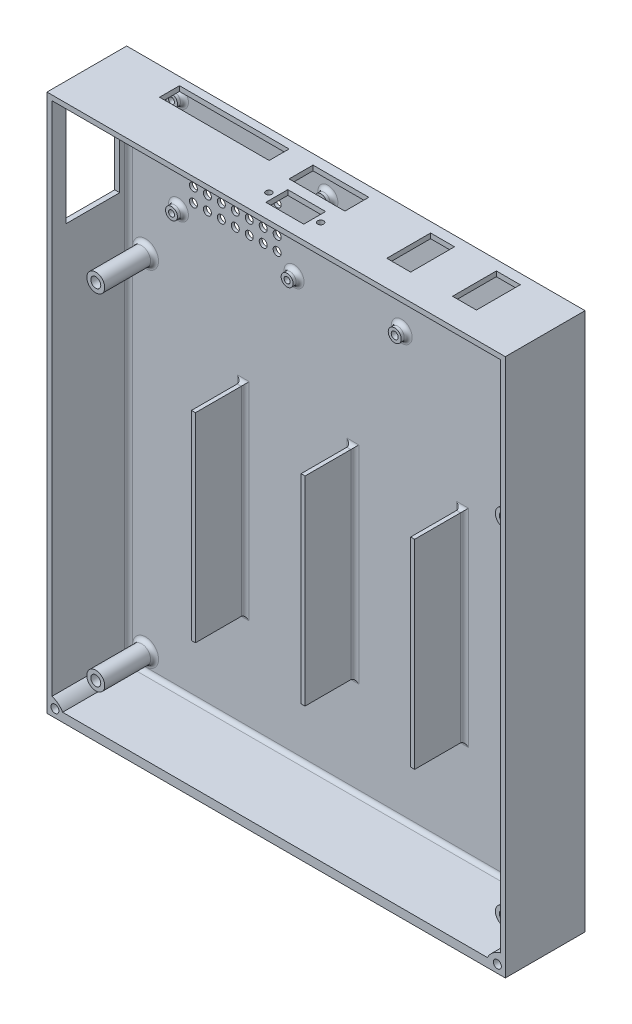
from build123d import *

# Parameters (mm, degrees)
ESQUISSE1_W             = 230
ESQUISSE1_H             = 270
BOSS_EXTRU_1_DEPTH      = 5
ESQUISSE2_R             = 2
ESQUISSE2_R_2           = 1.75
ESQUISSE2_R_3           = 1.5
ENL_V_MAT_EXTRU_1_DEPTH = 5
COQUE3_T                = -1.5
ESQUISSE3_R             = 4.5
ESQUISSE3_R_2           = 2.5
BOSS_EXTRU_3_DEPTH      = 25
ESQUISSE4_W             = 1
ESQUISSE4_H             = 267
BOSS_EXTRU_4_DEPTH      = 3.5
ESQUISSE5_W             = 225
ESQUISSE5_H             = 1
ESQUISSE5_H_2           = 2.9
BOSS_EXTRU_10_DEPTH     = 3.5
ESQUISSE7_W             = 2
ESQUISSE7_H             = 100
BOSS_EXTRU_11_DEPTH     = 25
ESQUISSE8_W             = 230
ESQUISSE8_H             = 270
ESQUISSE8_W_2           = 225
ESQUISSE8_H_2           = 263.1
BOSS_EXTRU_12_DEPTH     = 35
CONG_1_R                = 2
ESQUISSE11_W            = 55
ESQUISSE11_H            = 10
ESQUISSE11_W_2          = 28
ESQUISSE11_H_2          = 12
ESQUISSE11_W_3          = 12
ESQUISSE11_H_3          = 22
ENL_V_MAT_EXTRU_3_DEPTH = 10
ESQUISSE13_W            = 27
ESQUISSE13_H            = 55
ENL_V_MAT_EXTRU_4_DEPTH = 10
ESQUISSE14_R            = 2
ENL_V_MAT_EXTRU_5_DEPTH = 10
BOSS_EXTRU_13_DEPTH     = 40
BOSS_EXTRU_14_START     = 13.5
BOSS_EXTRU_14_DEPTH     = 40
ENL_V_START             = 13.5
ESQUISSE17_R            = 2
ENL_V_MAT_EXTRU_6_DEPTH = 40
ESQUISSE18_R            = 2
ENL_V_MAT_EXTRU_7_DEPTH = 40
ESQUISSE21_R            = 1.5
ESQUISSE21_W            = 19
ESQUISSE21_H            = 11
ENL_V_MAT_EXTRU_8_DEPTH = 2.5


with BuildPart() as part:
    # Esquisse1 → Boss.-Extru.1 (new body)
    with BuildSketch(Plane.XY):
        with Locations((0, -41.5625)):
            Rectangle(ESQUISSE1_W, ESQUISSE1_H)
    extrude(amount=BOSS_EXTRU_1_DEPTH)

    # Esquisse2 → Enlèv. mat.-Extru.1 (cut)
    with BuildSketch(Plane.XY.offset(5)):
        with Locations((-104, -163.5625)):
            Circle(ESQUISSE2_R)
        with Locations(Location((-104, 9.4375, 0), (0, 0, 180))):
            Circle(ESQUISSE2_R)
        with Locations((104.5, 82.9375)):
            Circle(ESQUISSE2_R_2)
        with Locations((24.5, 82.9375)):
            Circle(ESQUISSE2_R_2)
        with Locations(Location((24.5, 39.9375, 0), (0, 0, 180))):
            Circle(ESQUISSE2_R_2)
        with Locations(Location((104.5, 39.9375, 0), (0, 0, 180))):
            Circle(ESQUISSE2_R_2)
        with Locations((-87.5, 85.9375)):
            Circle(ESQUISSE2_R_3)
        with Locations(Location((-29.5, 85.9375, 0), (0, 0, 180))):
            Circle(ESQUISSE2_R_3)
        with Locations((8.5, 67.4375)):
            Circle(ESQUISSE2_R_3)
        with Locations(Location((-12.5, 67.4375, 0), (0, 0, 180))):
            Circle(ESQUISSE2_R_3)
        with Locations((-12.5, 79.9375)):
            Circle(ESQUISSE2_R_3)
        with Locations(Location((8.5, 79.9375, 0), (0, 0, 180))):
            Circle(ESQUISSE2_R_3)
        with Locations(Location((101, -163.5625, 0), (0, 0, 180))):
            Circle(ESQUISSE2_R)
        with Locations((101, 9.4375)):
            Circle(ESQUISSE2_R)
        with Locations(Location((-87.5, 36.9375, 0), (0, 0, 180))):
            Circle(ESQUISSE2_R_3)
        with Locations((-29.5, 36.9375)):
            Circle(ESQUISSE2_R_3)
    extrude(amount=-ENL_V_MAT_EXTRU_1_DEPTH, mode=Mode.SUBTRACT)

    # Coque3
    coque3_openings = [part.faces().sort_by_distance(p)[0] for p in [
        (-0.011238138, -41.697281592, 5),
    ]]
    offset(amount=COQUE3_T, openings=coque3_openings, kind=Kind.INTERSECTION)

    # Esquisse3 → Boss.-Extru.3 (add)
    # profile 1 of 4: a face of its own
    with BuildSketch(Plane.XY.offset(1.5)):
        with Locations(Location((-104, 9.4375, 0), (0, 0, 180))):
            Circle(ESQUISSE3_R)
        with Locations(Location((-104, 9.4375, 0), (0, 0, 180))):
            Circle(ESQUISSE3_R_2, mode=Mode.SUBTRACT)
    # profile 2 of 4: a face of its own
    with BuildSketch(Plane.XY.offset(1.5)):
        with Locations(Location((-104, -163.5625, 0), (0, 0, 180))):
            Circle(ESQUISSE3_R)
        with Locations(Location((-104, -163.5625, 0), (0, 0, 180))):
            Circle(ESQUISSE3_R_2, mode=Mode.SUBTRACT)
    # profile 3 of 4: a face of its own
    with BuildSketch(Plane.XY.offset(1.5)):
        with Locations(Location((101, -163.5625, 0), (0, 0, 180))):
            Circle(ESQUISSE3_R)
        with Locations(Location((101, -163.5625, 0), (0, 0, 180))):
            Circle(ESQUISSE3_R_2, mode=Mode.SUBTRACT)
    # profile 4 of 4: a face of its own
    with BuildSketch(Plane.XY.offset(1.5)):
        with Locations(Location((101, 9.4375, 0), (0, 0, 180))):
            Circle(ESQUISSE3_R)
        with Locations(Location((101, 9.4375, 0), (0, 0, 180))):
            Circle(ESQUISSE3_R_2, mode=Mode.SUBTRACT)
    extrude(amount=BOSS_EXTRU_3_DEPTH)

    # Esquisse4 → Boss.-Extru.4 (add)
    with BuildSketch(Plane.XY.offset(1.5)):
        with Locations((-113, -41.5625)):
            Rectangle(ESQUISSE4_W, ESQUISSE4_H)
        with Locations((113, -41.5625)):
            Rectangle(ESQUISSE4_W, ESQUISSE4_H)
    extrude(amount=BOSS_EXTRU_4_DEPTH)

    # Esquisse5 → Boss.-Extru.10 (add)
    with BuildSketch(Plane.XY.offset(1.5)):
        with Locations((0, 91.4375)):
            Rectangle(ESQUISSE5_W, ESQUISSE5_H)
        with Locations((0, -173.6125)):
            Rectangle(ESQUISSE5_W, ESQUISSE5_H_2)
    extrude(amount=BOSS_EXTRU_10_DEPTH)

    # Esquisse7 → Boss.-Extru.11 (add)
    with BuildSketch(Plane.XY.offset(1.5)):
        with Locations((0, -72.1625)):
            Rectangle(ESQUISSE7_W, ESQUISSE7_H)
        with Locations((-55, -72.1625)):
            Rectangle(ESQUISSE7_W, ESQUISSE7_H)
        with Locations((55, -72.1625)):
            Rectangle(ESQUISSE7_W, ESQUISSE7_H)
    extrude(amount=BOSS_EXTRU_11_DEPTH)

    # Esquisse8 → Boss.-Extru.12 (add)
    with BuildSketch(Plane.XY.offset(5)):
        with Locations((0, -41.5625)):
            Rectangle(ESQUISSE8_W, ESQUISSE8_H)
        with Locations((0, -40.6125)):
            Rectangle(ESQUISSE8_W_2, ESQUISSE8_H_2, mode=Mode.SUBTRACT)
    extrude(amount=BOSS_EXTRU_12_DEPTH)

    # Congé1
    # the kernel refuses this fillet: 2 mm, written as the material it adds along each edge
    with BuildSketch(Plane(origin=(-104, 9.4375, 1.5), x_dir=(-1, 0, 0), z_dir=(0, 1, 0))) as cong_1_piece_1:
        with BuildLine():
            CenterArc((4.5 + CONG_1_R, CONG_1_R), CONG_1_R, 180, 90)
            Line((4.5, CONG_1_R), (4.5 - CONG_1_R * 0.02, CONG_1_R))
            Line((4.5 - CONG_1_R * 0.02, CONG_1_R), (4.5 - CONG_1_R * 0.02, -CONG_1_R * 0.02))
            Line((4.5 - CONG_1_R * 0.02, -CONG_1_R * 0.02), (4.5 + CONG_1_R, -CONG_1_R * 0.02))
            Line((4.5 + CONG_1_R, -CONG_1_R * 0.02), (4.5 + CONG_1_R, 0))
        make_face()
    revolve(axis=Axis((-104, 9.4375, 1.5), (0, 0, 1)))
    with BuildSketch(Plane(origin=(101, -163.5625, 1.5), x_dir=(-1, 0, 0), z_dir=(0, 1, 0))) as cong_1_piece_2:
        with BuildLine():
            CenterArc((4.5 + CONG_1_R, CONG_1_R), CONG_1_R, 180, 90)
            Line((4.5, CONG_1_R), (4.5 - CONG_1_R * 0.02, CONG_1_R))
            Line((4.5 - CONG_1_R * 0.02, CONG_1_R), (4.5 - CONG_1_R * 0.02, -CONG_1_R * 0.02))
            Line((4.5 - CONG_1_R * 0.02, -CONG_1_R * 0.02), (4.5 + CONG_1_R, -CONG_1_R * 0.02))
            Line((4.5 + CONG_1_R, -CONG_1_R * 0.02), (4.5 + CONG_1_R, 0))
        make_face()
    revolve(axis=Axis((101, -163.5625, 1.5), (0, 0, 1)))
    with BuildSketch(Plane(origin=(-104, -163.5625, 1.5), x_dir=(-1, 0, 0), z_dir=(0, 1, 0))) as cong_1_piece_3:
        with BuildLine():
            CenterArc((4.5 + CONG_1_R, CONG_1_R), CONG_1_R, 180, 90)
            Line((4.5, CONG_1_R), (4.5 - CONG_1_R * 0.02, CONG_1_R))
            Line((4.5 - CONG_1_R * 0.02, CONG_1_R), (4.5 - CONG_1_R * 0.02, -CONG_1_R * 0.02))
            Line((4.5 - CONG_1_R * 0.02, -CONG_1_R * 0.02), (4.5 + CONG_1_R, -CONG_1_R * 0.02))
            Line((4.5 + CONG_1_R, -CONG_1_R * 0.02), (4.5 + CONG_1_R, 0))
        make_face()
    revolve(axis=Axis((-104, -163.5625, 1.5), (0, 0, 1)))
    with BuildSketch(Plane(origin=(101, 9.4375, 1.5), x_dir=(-1, 0, 0), z_dir=(0, 1, 0))) as cong_1_piece_4:
        with BuildLine():
            CenterArc((4.5 + CONG_1_R, CONG_1_R), CONG_1_R, 180, 90)
            Line((4.5, CONG_1_R), (4.5 - CONG_1_R * 0.02, CONG_1_R))
            Line((4.5 - CONG_1_R * 0.02, CONG_1_R), (4.5 - CONG_1_R * 0.02, -CONG_1_R * 0.02))
            Line((4.5 - CONG_1_R * 0.02, -CONG_1_R * 0.02), (4.5 + CONG_1_R, -CONG_1_R * 0.02))
            Line((4.5 + CONG_1_R, -CONG_1_R * 0.02), (4.5 + CONG_1_R, 0))
        make_face()
    revolve(axis=Axis((101, 9.4375, 1.5), (0, 0, 1)))
    with BuildSketch(Plane(origin=(112.5, -172.1625, 1.5), x_dir=(-1, 0, 0), z_dir=(0, 1, 0)), Plane(origin=(-112.5, 90.9375, 1.5), x_dir=(1, 0, 0), z_dir=(0, -1, 0))) as cong_1_piece_5:
        with BuildLine():
            CenterArc((CONG_1_R, CONG_1_R), CONG_1_R, 180, 90)
            Line((0, CONG_1_R), (-CONG_1_R * 0.02, CONG_1_R))
            Line((-CONG_1_R * 0.02, CONG_1_R), (-CONG_1_R * 0.02, -CONG_1_R * 0.02))
            Line((-CONG_1_R * 0.02, -CONG_1_R * 0.02), (CONG_1_R, -CONG_1_R * 0.02))
            Line((CONG_1_R, -CONG_1_R * 0.02), (CONG_1_R, 0))
        make_face()
    extrude(amount=263.1)
    with BuildSketch(Plane(origin=(112.5, 90.9375, 1.5), x_dir=(0, -1, 0), z_dir=(-1, 0, 0)), Plane(origin=(-112.5, -172.1625, 1.5), x_dir=(0, 1, 0), z_dir=(1, 0, 0))) as cong_1_piece_6:
        with BuildLine():
            CenterArc((CONG_1_R, CONG_1_R), CONG_1_R, 180, 90)
            Line((0, CONG_1_R), (-CONG_1_R * 0.02, CONG_1_R))
            Line((-CONG_1_R * 0.02, CONG_1_R), (-CONG_1_R * 0.02, -CONG_1_R * 0.02))
            Line((-CONG_1_R * 0.02, -CONG_1_R * 0.02), (CONG_1_R, -CONG_1_R * 0.02))
            Line((CONG_1_R, -CONG_1_R * 0.02), (CONG_1_R, 0))
        make_face()
    extrude(amount=225)
    with BuildSketch(Plane(origin=(-56, -122.1625, 1.5), x_dir=(-1, 0, 0), z_dir=(0, 1, 0)), Plane(origin=(-54, -22.1625, 1.5), x_dir=(1, 0, 0), z_dir=(0, -1, 0)), Plane(origin=(-1, -122.1625, 1.5), x_dir=(-1, 0, 0), z_dir=(0, 1, 0)), Plane(origin=(1, -22.1625, 1.5), x_dir=(1, 0, 0), z_dir=(0, -1, 0)), Plane(origin=(54, -122.1625, 1.5), x_dir=(-1, 0, 0), z_dir=(0, 1, 0)), Plane(origin=(56, -22.1625, 1.5), x_dir=(1, 0, 0), z_dir=(0, -1, 0))) as cong_1_piece_7:
        with BuildLine():
            CenterArc((CONG_1_R, CONG_1_R), CONG_1_R, 180, 90)
            Line((0, CONG_1_R), (-CONG_1_R * 0.02, CONG_1_R))
            Line((-CONG_1_R * 0.02, CONG_1_R), (-CONG_1_R * 0.02, -CONG_1_R * 0.02))
            Line((-CONG_1_R * 0.02, -CONG_1_R * 0.02), (CONG_1_R, -CONG_1_R * 0.02))
            Line((CONG_1_R, -CONG_1_R * 0.02), (CONG_1_R, 0))
        make_face()
    extrude(amount=100)
    with BuildSketch(Plane(origin=(-54, -122.1625, 1.5), x_dir=(0, -1, 0), z_dir=(-1, 0, 0)), Plane(origin=(-56, -22.1625, 1.5), x_dir=(0, 1, 0), z_dir=(1, 0, 0)), Plane(origin=(1, -122.1625, 1.5), x_dir=(0, -1, 0), z_dir=(-1, 0, 0)), Plane(origin=(-1, -22.1625, 1.5), x_dir=(0, 1, 0), z_dir=(1, 0, 0)), Plane(origin=(56, -122.1625, 1.5), x_dir=(0, -1, 0), z_dir=(-1, 0, 0)), Plane(origin=(54, -22.1625, 1.5), x_dir=(0, 1, 0), z_dir=(1, 0, 0))) as cong_1_piece_8:
        with BuildLine():
            CenterArc((CONG_1_R, CONG_1_R), CONG_1_R, 180, 90)
            Line((0, CONG_1_R), (-CONG_1_R * 0.02, CONG_1_R))
            Line((-CONG_1_R * 0.02, CONG_1_R), (-CONG_1_R * 0.02, -CONG_1_R * 0.02))
            Line((-CONG_1_R * 0.02, -CONG_1_R * 0.02), (CONG_1_R, -CONG_1_R * 0.02))
            Line((CONG_1_R, -CONG_1_R * 0.02), (CONG_1_R, 0))
        make_face()
    extrude(amount=2)
    with BuildSketch(Plane(origin=(104.5, 39.9375, 1.5), x_dir=(-1, 0, 0), z_dir=(0, 1, 0))) as cong_1_piece_9:
        with BuildLine():
            CenterArc((3.25 + CONG_1_R, CONG_1_R), CONG_1_R, 180, 90)
            Line((3.25, CONG_1_R), (3.25 - CONG_1_R * 0.02, CONG_1_R))
            Line((3.25 - CONG_1_R * 0.02, CONG_1_R), (3.25 - CONG_1_R * 0.02, -CONG_1_R * 0.02))
            Line((3.25 - CONG_1_R * 0.02, -CONG_1_R * 0.02), (3.25 + CONG_1_R, -CONG_1_R * 0.02))
            Line((3.25 + CONG_1_R, -CONG_1_R * 0.02), (3.25 + CONG_1_R, 0))
        make_face()
    revolve(axis=Axis((104.5, 39.9375, 1.5), (0, 0, 1)))
    with BuildSketch(Plane(origin=(24.5, 39.9375, 1.5), x_dir=(-1, 0, 0), z_dir=(0, 1, 0))) as cong_1_piece_10:
        with BuildLine():
            CenterArc((3.25 + CONG_1_R, CONG_1_R), CONG_1_R, 180, 90)
            Line((3.25, CONG_1_R), (3.25 - CONG_1_R * 0.02, CONG_1_R))
            Line((3.25 - CONG_1_R * 0.02, CONG_1_R), (3.25 - CONG_1_R * 0.02, -CONG_1_R * 0.02))
            Line((3.25 - CONG_1_R * 0.02, -CONG_1_R * 0.02), (3.25 + CONG_1_R, -CONG_1_R * 0.02))
            Line((3.25 + CONG_1_R, -CONG_1_R * 0.02), (3.25 + CONG_1_R, 0))
        make_face()
    revolve(axis=Axis((24.5, 39.9375, 1.5), (0, 0, 1)))
    with BuildSketch(Plane(origin=(24.5, 82.9375, 1.5), x_dir=(1, 0, 0), z_dir=(0, -1, 0))) as cong_1_piece_11:
        with BuildLine():
            CenterArc((3.25 + CONG_1_R, CONG_1_R), CONG_1_R, 180, 90)
            Line((3.25, CONG_1_R), (3.25 - CONG_1_R * 0.02, CONG_1_R))
            Line((3.25 - CONG_1_R * 0.02, CONG_1_R), (3.25 - CONG_1_R * 0.02, -CONG_1_R * 0.02))
            Line((3.25 - CONG_1_R * 0.02, -CONG_1_R * 0.02), (3.25 + CONG_1_R, -CONG_1_R * 0.02))
            Line((3.25 + CONG_1_R, -CONG_1_R * 0.02), (3.25 + CONG_1_R, 0))
        make_face()
    revolve(axis=Axis((24.5, 82.9375, 1.5), (0, 0, 1)))
    with BuildSketch(Plane(origin=(104.5, 82.9375, 1.5), x_dir=(1, 0, 0), z_dir=(0, -1, 0))) as cong_1_piece_12:
        with BuildLine():
            CenterArc((3.25 + CONG_1_R, CONG_1_R), CONG_1_R, 180, 90)
            Line((3.25 + CONG_1_R, 0), (3.25 + CONG_1_R, -CONG_1_R * 0.02))
            Line((3.25 + CONG_1_R, -CONG_1_R * 0.02), (3.25 - CONG_1_R * 0.02, -CONG_1_R * 0.02))
            Line((3.25 - CONG_1_R * 0.02, -CONG_1_R * 0.02), (3.25 - CONG_1_R * 0.02, CONG_1_R))
            Line((3.25 - CONG_1_R * 0.02, CONG_1_R), (3.25, CONG_1_R))
        make_face()
    revolve(axis=Axis((104.5, 82.9375, 1.5), (0, 0, 1)))
    with BuildSketch(Plane(origin=(8.5, 67.4375, 1.5), x_dir=(1, 0, 0), z_dir=(0, -1, 0))) as cong_1_piece_13:
        with BuildLine():
            CenterArc((3 + CONG_1_R, CONG_1_R), CONG_1_R, 180, 90)
            Line((3, CONG_1_R), (3 - CONG_1_R * 0.02, CONG_1_R))
            Line((3 - CONG_1_R * 0.02, CONG_1_R), (3 - CONG_1_R * 0.02, -CONG_1_R * 0.02))
            Line((3 - CONG_1_R * 0.02, -CONG_1_R * 0.02), (3 + CONG_1_R, -CONG_1_R * 0.02))
            Line((3 + CONG_1_R, -CONG_1_R * 0.02), (3 + CONG_1_R, 0))
        make_face()
    revolve(axis=Axis((8.5, 67.4375, 1.5), (0, 0, 1)))
    with BuildSketch(Plane(origin=(-87.5, 85.9375, 1.5), x_dir=(1, 0, 0), z_dir=(0, -1, 0))) as cong_1_piece_14:
        with BuildLine():
            CenterArc((3 + CONG_1_R, CONG_1_R), CONG_1_R, 180, 90)
            Line((3, CONG_1_R), (3 - CONG_1_R * 0.02, CONG_1_R))
            Line((3 - CONG_1_R * 0.02, CONG_1_R), (3 - CONG_1_R * 0.02, -CONG_1_R * 0.02))
            Line((3 - CONG_1_R * 0.02, -CONG_1_R * 0.02), (3 + CONG_1_R, -CONG_1_R * 0.02))
            Line((3 + CONG_1_R, -CONG_1_R * 0.02), (3 + CONG_1_R, 0))
        make_face()
    revolve(axis=Axis((-87.5, 85.9375, 1.5), (0, 0, 1)))
    with BuildSketch(Plane(origin=(-29.5, 85.9375, 1.5), x_dir=(-1, 0, 0), z_dir=(0, 1, 0))) as cong_1_piece_15:
        with BuildLine():
            CenterArc((3 + CONG_1_R, CONG_1_R), CONG_1_R, 180, 90)
            Line((3, CONG_1_R), (3 - CONG_1_R * 0.02, CONG_1_R))
            Line((3 - CONG_1_R * 0.02, CONG_1_R), (3 - CONG_1_R * 0.02, -CONG_1_R * 0.02))
            Line((3 - CONG_1_R * 0.02, -CONG_1_R * 0.02), (3 + CONG_1_R, -CONG_1_R * 0.02))
            Line((3 + CONG_1_R, -CONG_1_R * 0.02), (3 + CONG_1_R, 0))
        make_face()
    revolve(axis=Axis((-29.5, 85.9375, 1.5), (0, 0, 1)))
    with BuildSketch(Plane(origin=(-87.5, 36.9375, 1.5), x_dir=(-1, 0, 0), z_dir=(0, 1, 0))) as cong_1_piece_16:
        with BuildLine():
            CenterArc((3 + CONG_1_R, CONG_1_R), CONG_1_R, 180, 90)
            Line((3, CONG_1_R), (3 - CONG_1_R * 0.02, CONG_1_R))
            Line((3 - CONG_1_R * 0.02, CONG_1_R), (3 - CONG_1_R * 0.02, -CONG_1_R * 0.02))
            Line((3 - CONG_1_R * 0.02, -CONG_1_R * 0.02), (3 + CONG_1_R, -CONG_1_R * 0.02))
            Line((3 + CONG_1_R, -CONG_1_R * 0.02), (3 + CONG_1_R, 0))
        make_face()
    revolve(axis=Axis((-87.5, 36.9375, 1.5), (0, 0, 1)))
    with BuildSketch(Plane(origin=(-29.5, 36.9375, 1.5), x_dir=(1, 0, 0), z_dir=(0, -1, 0))) as cong_1_piece_17:
        with BuildLine():
            CenterArc((3 + CONG_1_R, CONG_1_R), CONG_1_R, 180, 90)
            Line((3, CONG_1_R), (3 - CONG_1_R * 0.02, CONG_1_R))
            Line((3 - CONG_1_R * 0.02, CONG_1_R), (3 - CONG_1_R * 0.02, -CONG_1_R * 0.02))
            Line((3 - CONG_1_R * 0.02, -CONG_1_R * 0.02), (3 + CONG_1_R, -CONG_1_R * 0.02))
            Line((3 + CONG_1_R, -CONG_1_R * 0.02), (3 + CONG_1_R, 0))
        make_face()
    revolve(axis=Axis((-29.5, 36.9375, 1.5), (0, 0, 1)))
    with BuildSketch(Plane(origin=(-12.5, 67.4375, 1.5), x_dir=(-1, 0, 0), z_dir=(0, 1, 0))) as cong_1_piece_18:
        with BuildLine():
            CenterArc((3 + CONG_1_R, CONG_1_R), CONG_1_R, 180, 90)
            Line((3, CONG_1_R), (3 - CONG_1_R * 0.02, CONG_1_R))
            Line((3 - CONG_1_R * 0.02, CONG_1_R), (3 - CONG_1_R * 0.02, -CONG_1_R * 0.02))
            Line((3 - CONG_1_R * 0.02, -CONG_1_R * 0.02), (3 + CONG_1_R, -CONG_1_R * 0.02))
            Line((3 + CONG_1_R, -CONG_1_R * 0.02), (3 + CONG_1_R, 0))
        make_face()
    revolve(axis=Axis((-12.5, 67.4375, 1.5), (0, 0, 1)))
    with BuildSketch(Plane(origin=(-12.5, 79.9375, 1.5), x_dir=(1, 0, 0), z_dir=(0, -1, 0))) as cong_1_piece_19:
        with BuildLine():
            CenterArc((3 + CONG_1_R, CONG_1_R), CONG_1_R, 180, 90)
            Line((3, CONG_1_R), (3 - CONG_1_R * 0.02, CONG_1_R))
            Line((3 - CONG_1_R * 0.02, CONG_1_R), (3 - CONG_1_R * 0.02, -CONG_1_R * 0.02))
            Line((3 - CONG_1_R * 0.02, -CONG_1_R * 0.02), (3 + CONG_1_R, -CONG_1_R * 0.02))
            Line((3 + CONG_1_R, -CONG_1_R * 0.02), (3 + CONG_1_R, 0))
        make_face()
    revolve(axis=Axis((-12.5, 79.9375, 1.5), (0, 0, 1)))
    with BuildSketch(Plane(origin=(8.5, 79.9375, 1.5), x_dir=(-1, 0, 0), z_dir=(0, 1, 0))) as cong_1_piece_20:
        with BuildLine():
            CenterArc((3 + CONG_1_R, CONG_1_R), CONG_1_R, 180, 90)
            Line((3, CONG_1_R), (3 - CONG_1_R * 0.02, CONG_1_R))
            Line((3 - CONG_1_R * 0.02, CONG_1_R), (3 - CONG_1_R * 0.02, -CONG_1_R * 0.02))
            Line((3 - CONG_1_R * 0.02, -CONG_1_R * 0.02), (3 + CONG_1_R, -CONG_1_R * 0.02))
            Line((3 + CONG_1_R, -CONG_1_R * 0.02), (3 + CONG_1_R, 0))
        make_face()
    revolve(axis=Axis((8.5, 79.9375, 1.5), (0, 0, 1)))
    with BuildSketch(Plane(origin=(-112.5, -172.1625, 1.5), x_dir=(0, 1, 0), z_dir=(1, 0, 0))) as cong_1_piece_21a_section:
        with BuildLine():
            CenterArc((CONG_1_R, CONG_1_R), CONG_1_R, 180, 90)
            Line((0, CONG_1_R), (-CONG_1_R * 0.02, CONG_1_R))
            Line((-CONG_1_R * 0.02, CONG_1_R), (-CONG_1_R * 0.02, -CONG_1_R * 0.02))
            Line((-CONG_1_R * 0.02, -CONG_1_R * 0.02), (CONG_1_R, -CONG_1_R * 0.02))
            Line((CONG_1_R, -CONG_1_R * 0.02), (CONG_1_R, 0))
        make_face()
    cong_1_piece_21a = extrude(amount=230, mode=Mode.PRIVATE)
    cong_1_piece_21a = split(cong_1_piece_21a, bisect_by=Plane(origin=(112.5, -171.709709771, 1.952790229), z_dir=(1, 0, 0)), keep=Keep.TOP, mode=Mode.PRIVATE)
    with BuildSketch(Plane(origin=(112.5, -177.1625, 1.5), x_dir=(-1, 0, 0), z_dir=(0, 1, 0))) as cong_1_piece_21b_section:
        with BuildLine():
            CenterArc((CONG_1_R, CONG_1_R), CONG_1_R, 180, 90)
            Line((0, CONG_1_R), (-CONG_1_R * 0.02, CONG_1_R))
            Line((-CONG_1_R * 0.02, CONG_1_R), (-CONG_1_R * 0.02, -CONG_1_R * 0.02))
            Line((-CONG_1_R * 0.02, -CONG_1_R * 0.02), (CONG_1_R, -CONG_1_R * 0.02))
            Line((CONG_1_R, -CONG_1_R * 0.02), (CONG_1_R, 0))
        make_face()
    cong_1_piece_21b = extrude(amount=268.1, mode=Mode.PRIVATE)
    cong_1_piece_21b = split(cong_1_piece_21b, bisect_by=Plane(origin=(112.047209771, -172.1625, 1.952790229), z_dir=(0, -1, 0)), keep=Keep.TOP, mode=Mode.PRIVATE)
    cong_1_piece_21 = cong_1_piece_21a & cong_1_piece_21b
    add(cong_1_piece_21)
    with BuildSketch(Plane(origin=(112.5, -172.1625, 1.5), x_dir=(-1, 0, 0), z_dir=(0, 1, 0))) as cong_1_piece_22a_section:
        with BuildLine():
            CenterArc((CONG_1_R, CONG_1_R), CONG_1_R, 180, 90)
            Line((0, CONG_1_R), (-CONG_1_R * 0.02, CONG_1_R))
            Line((-CONG_1_R * 0.02, CONG_1_R), (-CONG_1_R * 0.02, -CONG_1_R * 0.02))
            Line((-CONG_1_R * 0.02, -CONG_1_R * 0.02), (CONG_1_R, -CONG_1_R * 0.02))
            Line((CONG_1_R, -CONG_1_R * 0.02), (CONG_1_R, 0))
        make_face()
    cong_1_piece_22a = extrude(amount=268.1, mode=Mode.PRIVATE)
    cong_1_piece_22a = split(cong_1_piece_22a, bisect_by=Plane(origin=(112.047209771, 90.9375, 1.952790229), z_dir=(0, 1, 0)), keep=Keep.TOP, mode=Mode.PRIVATE)
    with BuildSketch(Plane(origin=(117.5, 90.9375, 1.5), x_dir=(0, -1, 0), z_dir=(-1, 0, 0))) as cong_1_piece_22b_section:
        with BuildLine():
            CenterArc((CONG_1_R, CONG_1_R), CONG_1_R, 180, 90)
            Line((0, CONG_1_R), (-CONG_1_R * 0.02, CONG_1_R))
            Line((-CONG_1_R * 0.02, CONG_1_R), (-CONG_1_R * 0.02, -CONG_1_R * 0.02))
            Line((-CONG_1_R * 0.02, -CONG_1_R * 0.02), (CONG_1_R, -CONG_1_R * 0.02))
            Line((CONG_1_R, -CONG_1_R * 0.02), (CONG_1_R, 0))
        make_face()
    cong_1_piece_22b = extrude(amount=230, mode=Mode.PRIVATE)
    cong_1_piece_22b = split(cong_1_piece_22b, bisect_by=Plane(origin=(112.5, 90.484709771, 1.952790229), z_dir=(1, 0, 0)), keep=Keep.TOP, mode=Mode.PRIVATE)
    cong_1_piece_22 = cong_1_piece_22a & cong_1_piece_22b
    add(cong_1_piece_22)
    with BuildSketch(Plane(origin=(-112.5, 95.9375, 1.5), x_dir=(1, 0, 0), z_dir=(0, -1, 0))) as cong_1_piece_23a_section:
        with BuildLine():
            CenterArc((CONG_1_R, CONG_1_R), CONG_1_R, 180, 90)
            Line((0, CONG_1_R), (-CONG_1_R * 0.02, CONG_1_R))
            Line((-CONG_1_R * 0.02, CONG_1_R), (-CONG_1_R * 0.02, -CONG_1_R * 0.02))
            Line((-CONG_1_R * 0.02, -CONG_1_R * 0.02), (CONG_1_R, -CONG_1_R * 0.02))
            Line((CONG_1_R, -CONG_1_R * 0.02), (CONG_1_R, 0))
        make_face()
    cong_1_piece_23a = extrude(amount=268.1, mode=Mode.PRIVATE)
    cong_1_piece_23a = split(cong_1_piece_23a, bisect_by=Plane(origin=(-112.047209771, 90.9375, 1.952790229), z_dir=(0, 1, 0)), keep=Keep.TOP, mode=Mode.PRIVATE)
    with BuildSketch(Plane(origin=(112.5, 90.9375, 1.5), x_dir=(0, -1, 0), z_dir=(-1, 0, 0))) as cong_1_piece_23b_section:
        with BuildLine():
            CenterArc((CONG_1_R, CONG_1_R), CONG_1_R, 180, 90)
            Line((0, CONG_1_R), (-CONG_1_R * 0.02, CONG_1_R))
            Line((-CONG_1_R * 0.02, CONG_1_R), (-CONG_1_R * 0.02, -CONG_1_R * 0.02))
            Line((-CONG_1_R * 0.02, -CONG_1_R * 0.02), (CONG_1_R, -CONG_1_R * 0.02))
            Line((CONG_1_R, -CONG_1_R * 0.02), (CONG_1_R, 0))
        make_face()
    cong_1_piece_23b = extrude(amount=230, mode=Mode.PRIVATE)
    cong_1_piece_23b = split(cong_1_piece_23b, bisect_by=Plane(origin=(-112.5, 90.484709771, 1.952790229), z_dir=(-1, 0, 0)), keep=Keep.TOP, mode=Mode.PRIVATE)
    cong_1_piece_23 = cong_1_piece_23a & cong_1_piece_23b
    add(cong_1_piece_23)
    with BuildSketch(Plane(origin=(-117.5, -172.1625, 1.5), x_dir=(0, 1, 0), z_dir=(1, 0, 0))) as cong_1_piece_24a_section:
        with BuildLine():
            CenterArc((CONG_1_R, CONG_1_R), CONG_1_R, 180, 90)
            Line((0, CONG_1_R), (-CONG_1_R * 0.02, CONG_1_R))
            Line((-CONG_1_R * 0.02, CONG_1_R), (-CONG_1_R * 0.02, -CONG_1_R * 0.02))
            Line((-CONG_1_R * 0.02, -CONG_1_R * 0.02), (CONG_1_R, -CONG_1_R * 0.02))
            Line((CONG_1_R, -CONG_1_R * 0.02), (CONG_1_R, 0))
        make_face()
    cong_1_piece_24a = extrude(amount=230, mode=Mode.PRIVATE)
    cong_1_piece_24a = split(cong_1_piece_24a, bisect_by=Plane(origin=(-112.5, -171.709709771, 1.952790229), z_dir=(-1, 0, 0)), keep=Keep.TOP, mode=Mode.PRIVATE)
    with BuildSketch(Plane(origin=(-112.5, 90.9375, 1.5), x_dir=(1, 0, 0), z_dir=(0, -1, 0))) as cong_1_piece_24b_section:
        with BuildLine():
            CenterArc((CONG_1_R, CONG_1_R), CONG_1_R, 180, 90)
            Line((0, CONG_1_R), (-CONG_1_R * 0.02, CONG_1_R))
            Line((-CONG_1_R * 0.02, CONG_1_R), (-CONG_1_R * 0.02, -CONG_1_R * 0.02))
            Line((-CONG_1_R * 0.02, -CONG_1_R * 0.02), (CONG_1_R, -CONG_1_R * 0.02))
            Line((CONG_1_R, -CONG_1_R * 0.02), (CONG_1_R, 0))
        make_face()
    cong_1_piece_24b = extrude(amount=268.1, mode=Mode.PRIVATE)
    cong_1_piece_24b = split(cong_1_piece_24b, bisect_by=Plane(origin=(-112.047209771, -172.1625, 1.952790229), z_dir=(0, -1, 0)), keep=Keep.TOP, mode=Mode.PRIVATE)
    cong_1_piece_24 = cong_1_piece_24a & cong_1_piece_24b
    add(cong_1_piece_24)
    with BuildSketch(Plane(origin=(-56, -127.1625, 1.5), x_dir=(-1, 0, 0), z_dir=(0, 1, 0))) as cong_1_piece_25a_section:
        with BuildLine():
            CenterArc((CONG_1_R, CONG_1_R), CONG_1_R, 180, 90)
            Line((0, CONG_1_R), (-CONG_1_R * 0.02, CONG_1_R))
            Line((-CONG_1_R * 0.02, CONG_1_R), (-CONG_1_R * 0.02, -CONG_1_R * 0.02))
            Line((-CONG_1_R * 0.02, -CONG_1_R * 0.02), (CONG_1_R, -CONG_1_R * 0.02))
            Line((CONG_1_R, -CONG_1_R * 0.02), (CONG_1_R, 0))
        make_face()
    cong_1_piece_25a = extrude(amount=105, mode=Mode.PRIVATE)
    cong_1_piece_25a = split(cong_1_piece_25a, bisect_by=Plane(origin=(-56.452790229, -122.1625, 1.952790229), z_dir=(0, -1, 0)), keep=Keep.TOP, mode=Mode.PRIVATE)
    with BuildSketch(Plane(origin=(-54, -122.1625, 1.5), x_dir=(0, -1, 0), z_dir=(-1, 0, 0))) as cong_1_piece_25b_section:
        with BuildLine():
            CenterArc((CONG_1_R, CONG_1_R), CONG_1_R, 180, 90)
            Line((0, CONG_1_R), (-CONG_1_R * 0.02, CONG_1_R))
            Line((-CONG_1_R * 0.02, CONG_1_R), (-CONG_1_R * 0.02, -CONG_1_R * 0.02))
            Line((-CONG_1_R * 0.02, -CONG_1_R * 0.02), (CONG_1_R, -CONG_1_R * 0.02))
            Line((CONG_1_R, -CONG_1_R * 0.02), (CONG_1_R, 0))
        make_face()
    cong_1_piece_25b = extrude(amount=7, mode=Mode.PRIVATE)
    cong_1_piece_25b = split(cong_1_piece_25b, bisect_by=Plane(origin=(-56, -122.615290229, 1.952790229), z_dir=(-1, 0, 0)), keep=Keep.TOP, mode=Mode.PRIVATE)
    cong_1_piece_25 = cong_1_piece_25a & cong_1_piece_25b
    add(cong_1_piece_25)
    with BuildSketch(Plane(origin=(-56, -122.1625, 1.5), x_dir=(-1, 0, 0), z_dir=(0, 1, 0))) as cong_1_piece_26a_section:
        with BuildLine():
            CenterArc((CONG_1_R, CONG_1_R), CONG_1_R, 180, 90)
            Line((0, CONG_1_R), (-CONG_1_R * 0.02, CONG_1_R))
            Line((-CONG_1_R * 0.02, CONG_1_R), (-CONG_1_R * 0.02, -CONG_1_R * 0.02))
            Line((-CONG_1_R * 0.02, -CONG_1_R * 0.02), (CONG_1_R, -CONG_1_R * 0.02))
            Line((CONG_1_R, -CONG_1_R * 0.02), (CONG_1_R, 0))
        make_face()
    cong_1_piece_26a = extrude(amount=105, mode=Mode.PRIVATE)
    cong_1_piece_26a = split(cong_1_piece_26a, bisect_by=Plane(origin=(-56.452790229, -22.1625, 1.952790229), z_dir=(0, 1, 0)), keep=Keep.TOP, mode=Mode.PRIVATE)
    with BuildSketch(Plane(origin=(-61, -22.1625, 1.5), x_dir=(0, 1, 0), z_dir=(1, 0, 0))) as cong_1_piece_26b_section:
        with BuildLine():
            CenterArc((CONG_1_R, CONG_1_R), CONG_1_R, 180, 90)
            Line((0, CONG_1_R), (-CONG_1_R * 0.02, CONG_1_R))
            Line((-CONG_1_R * 0.02, CONG_1_R), (-CONG_1_R * 0.02, -CONG_1_R * 0.02))
            Line((-CONG_1_R * 0.02, -CONG_1_R * 0.02), (CONG_1_R, -CONG_1_R * 0.02))
            Line((CONG_1_R, -CONG_1_R * 0.02), (CONG_1_R, 0))
        make_face()
    cong_1_piece_26b = extrude(amount=7, mode=Mode.PRIVATE)
    cong_1_piece_26b = split(cong_1_piece_26b, bisect_by=Plane(origin=(-56, -21.709709771, 1.952790229), z_dir=(-1, 0, 0)), keep=Keep.TOP, mode=Mode.PRIVATE)
    cong_1_piece_26 = cong_1_piece_26a & cong_1_piece_26b
    add(cong_1_piece_26)
    with BuildSketch(Plane(origin=(-49, -122.1625, 1.5), x_dir=(0, -1, 0), z_dir=(-1, 0, 0))) as cong_1_piece_27a_section:
        with BuildLine():
            CenterArc((CONG_1_R, CONG_1_R), CONG_1_R, 180, 90)
            Line((0, CONG_1_R), (-CONG_1_R * 0.02, CONG_1_R))
            Line((-CONG_1_R * 0.02, CONG_1_R), (-CONG_1_R * 0.02, -CONG_1_R * 0.02))
            Line((-CONG_1_R * 0.02, -CONG_1_R * 0.02), (CONG_1_R, -CONG_1_R * 0.02))
            Line((CONG_1_R, -CONG_1_R * 0.02), (CONG_1_R, 0))
        make_face()
    cong_1_piece_27a = extrude(amount=7, mode=Mode.PRIVATE)
    cong_1_piece_27a = split(cong_1_piece_27a, bisect_by=Plane(origin=(-54, -122.615290229, 1.952790229), z_dir=(1, 0, 0)), keep=Keep.TOP, mode=Mode.PRIVATE)
    with BuildSketch(Plane(origin=(-54, -22.1625, 1.5), x_dir=(1, 0, 0), z_dir=(0, -1, 0))) as cong_1_piece_27b_section:
        with BuildLine():
            CenterArc((CONG_1_R, CONG_1_R), CONG_1_R, 180, 90)
            Line((0, CONG_1_R), (-CONG_1_R * 0.02, CONG_1_R))
            Line((-CONG_1_R * 0.02, CONG_1_R), (-CONG_1_R * 0.02, -CONG_1_R * 0.02))
            Line((-CONG_1_R * 0.02, -CONG_1_R * 0.02), (CONG_1_R, -CONG_1_R * 0.02))
            Line((CONG_1_R, -CONG_1_R * 0.02), (CONG_1_R, 0))
        make_face()
    cong_1_piece_27b = extrude(amount=105, mode=Mode.PRIVATE)
    cong_1_piece_27b = split(cong_1_piece_27b, bisect_by=Plane(origin=(-53.547209771, -122.1625, 1.952790229), z_dir=(0, -1, 0)), keep=Keep.TOP, mode=Mode.PRIVATE)
    cong_1_piece_27 = cong_1_piece_27a & cong_1_piece_27b
    add(cong_1_piece_27)
    with BuildSketch(Plane(origin=(-54, -17.1625, 1.5), x_dir=(1, 0, 0), z_dir=(0, -1, 0))) as cong_1_piece_28a_section:
        with BuildLine():
            CenterArc((CONG_1_R, CONG_1_R), CONG_1_R, 180, 90)
            Line((0, CONG_1_R), (-CONG_1_R * 0.02, CONG_1_R))
            Line((-CONG_1_R * 0.02, CONG_1_R), (-CONG_1_R * 0.02, -CONG_1_R * 0.02))
            Line((-CONG_1_R * 0.02, -CONG_1_R * 0.02), (CONG_1_R, -CONG_1_R * 0.02))
            Line((CONG_1_R, -CONG_1_R * 0.02), (CONG_1_R, 0))
        make_face()
    cong_1_piece_28a = extrude(amount=105, mode=Mode.PRIVATE)
    cong_1_piece_28a = split(cong_1_piece_28a, bisect_by=Plane(origin=(-53.547209771, -22.1625, 1.952790229), z_dir=(0, 1, 0)), keep=Keep.TOP, mode=Mode.PRIVATE)
    with BuildSketch(Plane(origin=(-56, -22.1625, 1.5), x_dir=(0, 1, 0), z_dir=(1, 0, 0))) as cong_1_piece_28b_section:
        with BuildLine():
            CenterArc((CONG_1_R, CONG_1_R), CONG_1_R, 180, 90)
            Line((0, CONG_1_R), (-CONG_1_R * 0.02, CONG_1_R))
            Line((-CONG_1_R * 0.02, CONG_1_R), (-CONG_1_R * 0.02, -CONG_1_R * 0.02))
            Line((-CONG_1_R * 0.02, -CONG_1_R * 0.02), (CONG_1_R, -CONG_1_R * 0.02))
            Line((CONG_1_R, -CONG_1_R * 0.02), (CONG_1_R, 0))
        make_face()
    cong_1_piece_28b = extrude(amount=7, mode=Mode.PRIVATE)
    cong_1_piece_28b = split(cong_1_piece_28b, bisect_by=Plane(origin=(-54, -21.709709771, 1.952790229), z_dir=(1, 0, 0)), keep=Keep.TOP, mode=Mode.PRIVATE)
    cong_1_piece_28 = cong_1_piece_28a & cong_1_piece_28b
    add(cong_1_piece_28)
    with BuildSketch(Plane(origin=(-1, -127.1625, 1.5), x_dir=(-1, 0, 0), z_dir=(0, 1, 0))) as cong_1_piece_29a_section:
        with BuildLine():
            CenterArc((CONG_1_R, CONG_1_R), CONG_1_R, 180, 90)
            Line((0, CONG_1_R), (-CONG_1_R * 0.02, CONG_1_R))
            Line((-CONG_1_R * 0.02, CONG_1_R), (-CONG_1_R * 0.02, -CONG_1_R * 0.02))
            Line((-CONG_1_R * 0.02, -CONG_1_R * 0.02), (CONG_1_R, -CONG_1_R * 0.02))
            Line((CONG_1_R, -CONG_1_R * 0.02), (CONG_1_R, 0))
        make_face()
    cong_1_piece_29a = extrude(amount=105, mode=Mode.PRIVATE)
    cong_1_piece_29a = split(cong_1_piece_29a, bisect_by=Plane(origin=(-1.452790229, -122.1625, 1.952790229), z_dir=(0, -1, 0)), keep=Keep.TOP, mode=Mode.PRIVATE)
    with BuildSketch(Plane(origin=(1, -122.1625, 1.5), x_dir=(0, -1, 0), z_dir=(-1, 0, 0))) as cong_1_piece_29b_section:
        with BuildLine():
            CenterArc((CONG_1_R, CONG_1_R), CONG_1_R, 180, 90)
            Line((0, CONG_1_R), (-CONG_1_R * 0.02, CONG_1_R))
            Line((-CONG_1_R * 0.02, CONG_1_R), (-CONG_1_R * 0.02, -CONG_1_R * 0.02))
            Line((-CONG_1_R * 0.02, -CONG_1_R * 0.02), (CONG_1_R, -CONG_1_R * 0.02))
            Line((CONG_1_R, -CONG_1_R * 0.02), (CONG_1_R, 0))
        make_face()
    cong_1_piece_29b = extrude(amount=7, mode=Mode.PRIVATE)
    cong_1_piece_29b = split(cong_1_piece_29b, bisect_by=Plane(origin=(-1, -122.615290229, 1.952790229), z_dir=(-1, 0, 0)), keep=Keep.TOP, mode=Mode.PRIVATE)
    cong_1_piece_29 = cong_1_piece_29a & cong_1_piece_29b
    add(cong_1_piece_29)
    with BuildSketch(Plane(origin=(-6, -22.1625, 1.5), x_dir=(0, 1, 0), z_dir=(1, 0, 0))) as cong_1_piece_30a_section:
        with BuildLine():
            CenterArc((CONG_1_R, CONG_1_R), CONG_1_R, 180, 90)
            Line((0, CONG_1_R), (-CONG_1_R * 0.02, CONG_1_R))
            Line((-CONG_1_R * 0.02, CONG_1_R), (-CONG_1_R * 0.02, -CONG_1_R * 0.02))
            Line((-CONG_1_R * 0.02, -CONG_1_R * 0.02), (CONG_1_R, -CONG_1_R * 0.02))
            Line((CONG_1_R, -CONG_1_R * 0.02), (CONG_1_R, 0))
        make_face()
    cong_1_piece_30a = extrude(amount=7, mode=Mode.PRIVATE)
    cong_1_piece_30a = split(cong_1_piece_30a, bisect_by=Plane(origin=(-1, -21.709709771, 1.952790229), z_dir=(-1, 0, 0)), keep=Keep.TOP, mode=Mode.PRIVATE)
    with BuildSketch(Plane(origin=(-1, -122.1625, 1.5), x_dir=(-1, 0, 0), z_dir=(0, 1, 0))) as cong_1_piece_30b_section:
        with BuildLine():
            CenterArc((CONG_1_R, CONG_1_R), CONG_1_R, 180, 90)
            Line((0, CONG_1_R), (-CONG_1_R * 0.02, CONG_1_R))
            Line((-CONG_1_R * 0.02, CONG_1_R), (-CONG_1_R * 0.02, -CONG_1_R * 0.02))
            Line((-CONG_1_R * 0.02, -CONG_1_R * 0.02), (CONG_1_R, -CONG_1_R * 0.02))
            Line((CONG_1_R, -CONG_1_R * 0.02), (CONG_1_R, 0))
        make_face()
    cong_1_piece_30b = extrude(amount=105, mode=Mode.PRIVATE)
    cong_1_piece_30b = split(cong_1_piece_30b, bisect_by=Plane(origin=(-1.452790229, -22.1625, 1.952790229), z_dir=(0, 1, 0)), keep=Keep.TOP, mode=Mode.PRIVATE)
    cong_1_piece_30 = cong_1_piece_30a & cong_1_piece_30b
    add(cong_1_piece_30)
    with BuildSketch(Plane(origin=(6, -122.1625, 1.5), x_dir=(0, -1, 0), z_dir=(-1, 0, 0))) as cong_1_piece_31a_section:
        with BuildLine():
            CenterArc((CONG_1_R, CONG_1_R), CONG_1_R, 180, 90)
            Line((0, CONG_1_R), (-CONG_1_R * 0.02, CONG_1_R))
            Line((-CONG_1_R * 0.02, CONG_1_R), (-CONG_1_R * 0.02, -CONG_1_R * 0.02))
            Line((-CONG_1_R * 0.02, -CONG_1_R * 0.02), (CONG_1_R, -CONG_1_R * 0.02))
            Line((CONG_1_R, -CONG_1_R * 0.02), (CONG_1_R, 0))
        make_face()
    cong_1_piece_31a = extrude(amount=7, mode=Mode.PRIVATE)
    cong_1_piece_31a = split(cong_1_piece_31a, bisect_by=Plane(origin=(1, -122.615290229, 1.952790229), z_dir=(1, 0, 0)), keep=Keep.TOP, mode=Mode.PRIVATE)
    with BuildSketch(Plane(origin=(1, -22.1625, 1.5), x_dir=(1, 0, 0), z_dir=(0, -1, 0))) as cong_1_piece_31b_section:
        with BuildLine():
            CenterArc((CONG_1_R, CONG_1_R), CONG_1_R, 180, 90)
            Line((0, CONG_1_R), (-CONG_1_R * 0.02, CONG_1_R))
            Line((-CONG_1_R * 0.02, CONG_1_R), (-CONG_1_R * 0.02, -CONG_1_R * 0.02))
            Line((-CONG_1_R * 0.02, -CONG_1_R * 0.02), (CONG_1_R, -CONG_1_R * 0.02))
            Line((CONG_1_R, -CONG_1_R * 0.02), (CONG_1_R, 0))
        make_face()
    cong_1_piece_31b = extrude(amount=105, mode=Mode.PRIVATE)
    cong_1_piece_31b = split(cong_1_piece_31b, bisect_by=Plane(origin=(1.452790229, -122.1625, 1.952790229), z_dir=(0, -1, 0)), keep=Keep.TOP, mode=Mode.PRIVATE)
    cong_1_piece_31 = cong_1_piece_31a & cong_1_piece_31b
    add(cong_1_piece_31)
    with BuildSketch(Plane(origin=(-1, -22.1625, 1.5), x_dir=(0, 1, 0), z_dir=(1, 0, 0))) as cong_1_piece_32a_section:
        with BuildLine():
            CenterArc((CONG_1_R, CONG_1_R), CONG_1_R, 180, 90)
            Line((0, CONG_1_R), (-CONG_1_R * 0.02, CONG_1_R))
            Line((-CONG_1_R * 0.02, CONG_1_R), (-CONG_1_R * 0.02, -CONG_1_R * 0.02))
            Line((-CONG_1_R * 0.02, -CONG_1_R * 0.02), (CONG_1_R, -CONG_1_R * 0.02))
            Line((CONG_1_R, -CONG_1_R * 0.02), (CONG_1_R, 0))
        make_face()
    cong_1_piece_32a = extrude(amount=7, mode=Mode.PRIVATE)
    cong_1_piece_32a = split(cong_1_piece_32a, bisect_by=Plane(origin=(1, -21.709709771, 1.952790229), z_dir=(1, 0, 0)), keep=Keep.TOP, mode=Mode.PRIVATE)
    with BuildSketch(Plane(origin=(1, -17.1625, 1.5), x_dir=(1, 0, 0), z_dir=(0, -1, 0))) as cong_1_piece_32b_section:
        with BuildLine():
            CenterArc((CONG_1_R, CONG_1_R), CONG_1_R, 180, 90)
            Line((0, CONG_1_R), (-CONG_1_R * 0.02, CONG_1_R))
            Line((-CONG_1_R * 0.02, CONG_1_R), (-CONG_1_R * 0.02, -CONG_1_R * 0.02))
            Line((-CONG_1_R * 0.02, -CONG_1_R * 0.02), (CONG_1_R, -CONG_1_R * 0.02))
            Line((CONG_1_R, -CONG_1_R * 0.02), (CONG_1_R, 0))
        make_face()
    cong_1_piece_32b = extrude(amount=105, mode=Mode.PRIVATE)
    cong_1_piece_32b = split(cong_1_piece_32b, bisect_by=Plane(origin=(1.452790229, -22.1625, 1.952790229), z_dir=(0, 1, 0)), keep=Keep.TOP, mode=Mode.PRIVATE)
    cong_1_piece_32 = cong_1_piece_32a & cong_1_piece_32b
    add(cong_1_piece_32)
    with BuildSketch(Plane(origin=(54, -127.1625, 1.5), x_dir=(-1, 0, 0), z_dir=(0, 1, 0))) as cong_1_piece_33a_section:
        with BuildLine():
            CenterArc((CONG_1_R, CONG_1_R), CONG_1_R, 180, 90)
            Line((0, CONG_1_R), (-CONG_1_R * 0.02, CONG_1_R))
            Line((-CONG_1_R * 0.02, CONG_1_R), (-CONG_1_R * 0.02, -CONG_1_R * 0.02))
            Line((-CONG_1_R * 0.02, -CONG_1_R * 0.02), (CONG_1_R, -CONG_1_R * 0.02))
            Line((CONG_1_R, -CONG_1_R * 0.02), (CONG_1_R, 0))
        make_face()
    cong_1_piece_33a = extrude(amount=105, mode=Mode.PRIVATE)
    cong_1_piece_33a = split(cong_1_piece_33a, bisect_by=Plane(origin=(53.547209771, -122.1625, 1.952790229), z_dir=(0, -1, 0)), keep=Keep.TOP, mode=Mode.PRIVATE)
    with BuildSketch(Plane(origin=(56, -122.1625, 1.5), x_dir=(0, -1, 0), z_dir=(-1, 0, 0))) as cong_1_piece_33b_section:
        with BuildLine():
            CenterArc((CONG_1_R, CONG_1_R), CONG_1_R, 180, 90)
            Line((0, CONG_1_R), (-CONG_1_R * 0.02, CONG_1_R))
            Line((-CONG_1_R * 0.02, CONG_1_R), (-CONG_1_R * 0.02, -CONG_1_R * 0.02))
            Line((-CONG_1_R * 0.02, -CONG_1_R * 0.02), (CONG_1_R, -CONG_1_R * 0.02))
            Line((CONG_1_R, -CONG_1_R * 0.02), (CONG_1_R, 0))
        make_face()
    cong_1_piece_33b = extrude(amount=7, mode=Mode.PRIVATE)
    cong_1_piece_33b = split(cong_1_piece_33b, bisect_by=Plane(origin=(54, -122.615290229, 1.952790229), z_dir=(-1, 0, 0)), keep=Keep.TOP, mode=Mode.PRIVATE)
    cong_1_piece_33 = cong_1_piece_33a & cong_1_piece_33b
    add(cong_1_piece_33)
    with BuildSketch(Plane(origin=(49, -22.1625, 1.5), x_dir=(0, 1, 0), z_dir=(1, 0, 0))) as cong_1_piece_34a_section:
        with BuildLine():
            CenterArc((CONG_1_R, CONG_1_R), CONG_1_R, 180, 90)
            Line((0, CONG_1_R), (-CONG_1_R * 0.02, CONG_1_R))
            Line((-CONG_1_R * 0.02, CONG_1_R), (-CONG_1_R * 0.02, -CONG_1_R * 0.02))
            Line((-CONG_1_R * 0.02, -CONG_1_R * 0.02), (CONG_1_R, -CONG_1_R * 0.02))
            Line((CONG_1_R, -CONG_1_R * 0.02), (CONG_1_R, 0))
        make_face()
    cong_1_piece_34a = extrude(amount=7, mode=Mode.PRIVATE)
    cong_1_piece_34a = split(cong_1_piece_34a, bisect_by=Plane(origin=(54, -21.709709771, 1.952790229), z_dir=(-1, 0, 0)), keep=Keep.TOP, mode=Mode.PRIVATE)
    with BuildSketch(Plane(origin=(54, -122.1625, 1.5), x_dir=(-1, 0, 0), z_dir=(0, 1, 0))) as cong_1_piece_34b_section:
        with BuildLine():
            CenterArc((CONG_1_R, CONG_1_R), CONG_1_R, 180, 90)
            Line((0, CONG_1_R), (-CONG_1_R * 0.02, CONG_1_R))
            Line((-CONG_1_R * 0.02, CONG_1_R), (-CONG_1_R * 0.02, -CONG_1_R * 0.02))
            Line((-CONG_1_R * 0.02, -CONG_1_R * 0.02), (CONG_1_R, -CONG_1_R * 0.02))
            Line((CONG_1_R, -CONG_1_R * 0.02), (CONG_1_R, 0))
        make_face()
    cong_1_piece_34b = extrude(amount=105, mode=Mode.PRIVATE)
    cong_1_piece_34b = split(cong_1_piece_34b, bisect_by=Plane(origin=(53.547209771, -22.1625, 1.952790229), z_dir=(0, 1, 0)), keep=Keep.TOP, mode=Mode.PRIVATE)
    cong_1_piece_34 = cong_1_piece_34a & cong_1_piece_34b
    add(cong_1_piece_34)
    with BuildSketch(Plane(origin=(61, -122.1625, 1.5), x_dir=(0, -1, 0), z_dir=(-1, 0, 0))) as cong_1_piece_35a_section:
        with BuildLine():
            CenterArc((CONG_1_R, CONG_1_R), CONG_1_R, 180, 90)
            Line((0, CONG_1_R), (-CONG_1_R * 0.02, CONG_1_R))
            Line((-CONG_1_R * 0.02, CONG_1_R), (-CONG_1_R * 0.02, -CONG_1_R * 0.02))
            Line((-CONG_1_R * 0.02, -CONG_1_R * 0.02), (CONG_1_R, -CONG_1_R * 0.02))
            Line((CONG_1_R, -CONG_1_R * 0.02), (CONG_1_R, 0))
        make_face()
    cong_1_piece_35a = extrude(amount=7, mode=Mode.PRIVATE)
    cong_1_piece_35a = split(cong_1_piece_35a, bisect_by=Plane(origin=(56, -122.615290229, 1.952790229), z_dir=(1, 0, 0)), keep=Keep.TOP, mode=Mode.PRIVATE)
    with BuildSketch(Plane(origin=(56, -22.1625, 1.5), x_dir=(1, 0, 0), z_dir=(0, -1, 0))) as cong_1_piece_35b_section:
        with BuildLine():
            CenterArc((CONG_1_R, CONG_1_R), CONG_1_R, 180, 90)
            Line((0, CONG_1_R), (-CONG_1_R * 0.02, CONG_1_R))
            Line((-CONG_1_R * 0.02, CONG_1_R), (-CONG_1_R * 0.02, -CONG_1_R * 0.02))
            Line((-CONG_1_R * 0.02, -CONG_1_R * 0.02), (CONG_1_R, -CONG_1_R * 0.02))
            Line((CONG_1_R, -CONG_1_R * 0.02), (CONG_1_R, 0))
        make_face()
    cong_1_piece_35b = extrude(amount=105, mode=Mode.PRIVATE)
    cong_1_piece_35b = split(cong_1_piece_35b, bisect_by=Plane(origin=(56.452790229, -122.1625, 1.952790229), z_dir=(0, -1, 0)), keep=Keep.TOP, mode=Mode.PRIVATE)
    cong_1_piece_35 = cong_1_piece_35a & cong_1_piece_35b
    add(cong_1_piece_35)
    with BuildSketch(Plane(origin=(54, -22.1625, 1.5), x_dir=(0, 1, 0), z_dir=(1, 0, 0))) as cong_1_piece_36a_section:
        with BuildLine():
            CenterArc((CONG_1_R, CONG_1_R), CONG_1_R, 180, 90)
            Line((0, CONG_1_R), (-CONG_1_R * 0.02, CONG_1_R))
            Line((-CONG_1_R * 0.02, CONG_1_R), (-CONG_1_R * 0.02, -CONG_1_R * 0.02))
            Line((-CONG_1_R * 0.02, -CONG_1_R * 0.02), (CONG_1_R, -CONG_1_R * 0.02))
            Line((CONG_1_R, -CONG_1_R * 0.02), (CONG_1_R, 0))
        make_face()
    cong_1_piece_36a = extrude(amount=7, mode=Mode.PRIVATE)
    cong_1_piece_36a = split(cong_1_piece_36a, bisect_by=Plane(origin=(56, -21.709709771, 1.952790229), z_dir=(1, 0, 0)), keep=Keep.TOP, mode=Mode.PRIVATE)
    with BuildSketch(Plane(origin=(56, -17.1625, 1.5), x_dir=(1, 0, 0), z_dir=(0, -1, 0))) as cong_1_piece_36b_section:
        with BuildLine():
            CenterArc((CONG_1_R, CONG_1_R), CONG_1_R, 180, 90)
            Line((0, CONG_1_R), (-CONG_1_R * 0.02, CONG_1_R))
            Line((-CONG_1_R * 0.02, CONG_1_R), (-CONG_1_R * 0.02, -CONG_1_R * 0.02))
            Line((-CONG_1_R * 0.02, -CONG_1_R * 0.02), (CONG_1_R, -CONG_1_R * 0.02))
            Line((CONG_1_R, -CONG_1_R * 0.02), (CONG_1_R, 0))
        make_face()
    cong_1_piece_36b = extrude(amount=105, mode=Mode.PRIVATE)
    cong_1_piece_36b = split(cong_1_piece_36b, bisect_by=Plane(origin=(56.452790229, -22.1625, 1.952790229), z_dir=(0, 1, 0)), keep=Keep.TOP, mode=Mode.PRIVATE)
    cong_1_piece_36 = cong_1_piece_36a & cong_1_piece_36b
    add(cong_1_piece_36)

    # Esquisse11 → Enlèv. mat.-Extru.3 (cut)
    with BuildSketch(Plane.XZ.offset(-90.9375)):
        with Locations((-57, 9)):
            Rectangle(ESQUISSE11_W, ESQUISSE11_H)
        with Locations((-2.5, 11)):
            Rectangle(ESQUISSE11_W_2, ESQUISSE11_H_2)
        with Locations((48.5, 16)):
            Rectangle(ESQUISSE11_W_3, ESQUISSE11_H_3)
        with Locations((81.5, 16)):
            Rectangle(ESQUISSE11_W_3, ESQUISSE11_H_3)
    extrude(amount=-ENL_V_MAT_EXTRU_3_DEPTH, mode=Mode.SUBTRACT)

    # Esquisse13 → Enlèv. mat.-Extru.4 (cut)
    with BuildSketch(Plane(origin=(-112.5, 0, 0), x_dir=(0, 0, -1), z_dir=(1, 0, 0))):
        with Locations((-19.5, 61.4375)):
            Rectangle(ESQUISSE13_W, ESQUISSE13_H)
    extrude(amount=-ENL_V_MAT_EXTRU_4_DEPTH, mode=Mode.SUBTRACT)

    # Esquisse14 → Enlèv. mat.-Extru.5 (cut)
    with BuildSketch(Plane.XY.offset(1.5)):
        with Locations((-80, 78.4375)):
            Circle(ESQUISSE14_R)
        with Locations((-73, 78.4375)):
            Circle(ESQUISSE14_R)
        with Locations((-66, 78.4375)):
            Circle(ESQUISSE14_R)
        with Locations((-59, 78.4375)):
            Circle(ESQUISSE14_R)
        with Locations((-52, 78.4375)):
            Circle(ESQUISSE14_R)
        with Locations((-45, 78.4375)):
            Circle(ESQUISSE14_R)
        with Locations((-38, 78.4375)):
            Circle(ESQUISSE14_R)
        with Locations((-73, 71.4375)):
            Circle(ESQUISSE14_R)
        with Locations((-66, 71.4375)):
            Circle(ESQUISSE14_R)
        with Locations((-59, 71.4375)):
            Circle(ESQUISSE14_R)
        with Locations((-52, 71.4375)):
            Circle(ESQUISSE14_R)
        with Locations((-45, 71.4375)):
            Circle(ESQUISSE14_R)
        with Locations((-38, 71.4375)):
            Circle(ESQUISSE14_R)
        with Locations((-73, 64.4375)):
            Circle(ESQUISSE14_R)
        with Locations((-66, 64.4375)):
            Circle(ESQUISSE14_R)
        with Locations((-59, 64.4375)):
            Circle(ESQUISSE14_R)
        with Locations((-52, 64.4375)):
            Circle(ESQUISSE14_R)
        with Locations((-45, 64.4375)):
            Circle(ESQUISSE14_R)
        with Locations((-38, 64.4375)):
            Circle(ESQUISSE14_R)
        with Locations((-73, 57.4375)):
            Circle(ESQUISSE14_R)
        with Locations((-66, 57.4375)):
            Circle(ESQUISSE14_R)
        with Locations((-59, 57.4375)):
            Circle(ESQUISSE14_R)
        with Locations((-52, 57.4375)):
            Circle(ESQUISSE14_R)
        with Locations((-45, 57.4375)):
            Circle(ESQUISSE14_R)
        with Locations((-38, 57.4375)):
            Circle(ESQUISSE14_R)
        with Locations((-73, 50.4375)):
            Circle(ESQUISSE14_R)
        with Locations((-66, 50.4375)):
            Circle(ESQUISSE14_R)
        with Locations((-59, 50.4375)):
            Circle(ESQUISSE14_R)
        with Locations((-52, 50.4375)):
            Circle(ESQUISSE14_R)
        with Locations((-45, 50.4375)):
            Circle(ESQUISSE14_R)
        with Locations((-38, 50.4375)):
            Circle(ESQUISSE14_R)
        with Locations((-73, 43.4375)):
            Circle(ESQUISSE14_R)
        with Locations((-66, 43.4375)):
            Circle(ESQUISSE14_R)
        with Locations((-59, 43.4375)):
            Circle(ESQUISSE14_R)
        with Locations((-52, 43.4375)):
            Circle(ESQUISSE14_R)
        with Locations((-45, 43.4375)):
            Circle(ESQUISSE14_R)
        with Locations((-38, 43.4375)):
            Circle(ESQUISSE14_R)
        with Locations((-80, 71.4375)):
            Circle(ESQUISSE14_R)
        with Locations((-80, 64.4375)):
            Circle(ESQUISSE14_R)
        with Locations((-80, 57.4375)):
            Circle(ESQUISSE14_R)
        with Locations((-80, 50.4375)):
            Circle(ESQUISSE14_R)
        with Locations((-80, 43.4375)):
            Circle(ESQUISSE14_R)
    extrude(amount=-ENL_V_MAT_EXTRU_5_DEPTH, mode=Mode.SUBTRACT)

    # Esquisse15 → Boss.-Extru.13 (add)
    with BuildSketch(Plane(origin=(0, 0, 0), x_dir=(-1, 0, 0), z_dir=(0, 0, -1))):
        with BuildLine():
            Line((115, -176.5625), (106, -176.5625))
            ThreePointArc((106, -176.5625), (108.636038969, -170.198538969), (115, -167.5625))
            Line((115, -167.5625), (115, -176.5625))
        make_face()
    extrude(amount=-BOSS_EXTRU_13_DEPTH)

    # Esquisse16 → Boss.-Extru.14 (add)
    with BuildSketch(Plane.XY.offset(26.5).offset(BOSS_EXTRU_14_START)):
        with BuildLine():
            Line((105, -176.5625), (115, -176.5625))
            Line((115, -176.5625), (115, -166.5625))
            ThreePointArc((115, -166.5625), (107.928932188, -169.491432188), (105, -176.5625))
        make_face()
    extrude(amount=-BOSS_EXTRU_14_DEPTH)

    # Esquisse17 → Enlèv. mat.-Extru.6 (cut)
    with BuildSketch(Plane.XY.offset(26.5).offset(ENL_V_START)):
        with Locations((-111, -172.5625)):
            Circle(ESQUISSE17_R)
    extrude(amount=-ENL_V_MAT_EXTRU_6_DEPTH, mode=Mode.SUBTRACT)

    # Esquisse18 → Enlèv. mat.-Extru.7 (cut)
    with BuildSketch(Plane.XY.offset(26.5).offset(ENL_V_START)):
        with Locations((111, -172.5625)):
            Circle(ESQUISSE18_R)
    extrude(amount=-ENL_V_MAT_EXTRU_7_DEPTH, mode=Mode.SUBTRACT)

    # Esquisse21 → Enlèv. mat.-Extru.8 (cut)
    with BuildSketch(Plane(origin=(0, 93.4375, 0), x_dir=(1, 0, 0), z_dir=(0, 1, 0))):
        with Locations(Location((10.342877393, -28, 0), (0, 0, 270))):
            Circle(ESQUISSE21_R)
        with Locations(Location((-15.657122607, -28, 0), (0, 0, 270))):
            Circle(ESQUISSE21_R)
        with Locations((-2.657122607, -27.5)):
            Rectangle(ESQUISSE21_W, ESQUISSE21_H)
    extrude(amount=-ENL_V_MAT_EXTRU_8_DEPTH, mode=Mode.SUBTRACT)


solid = part.part
